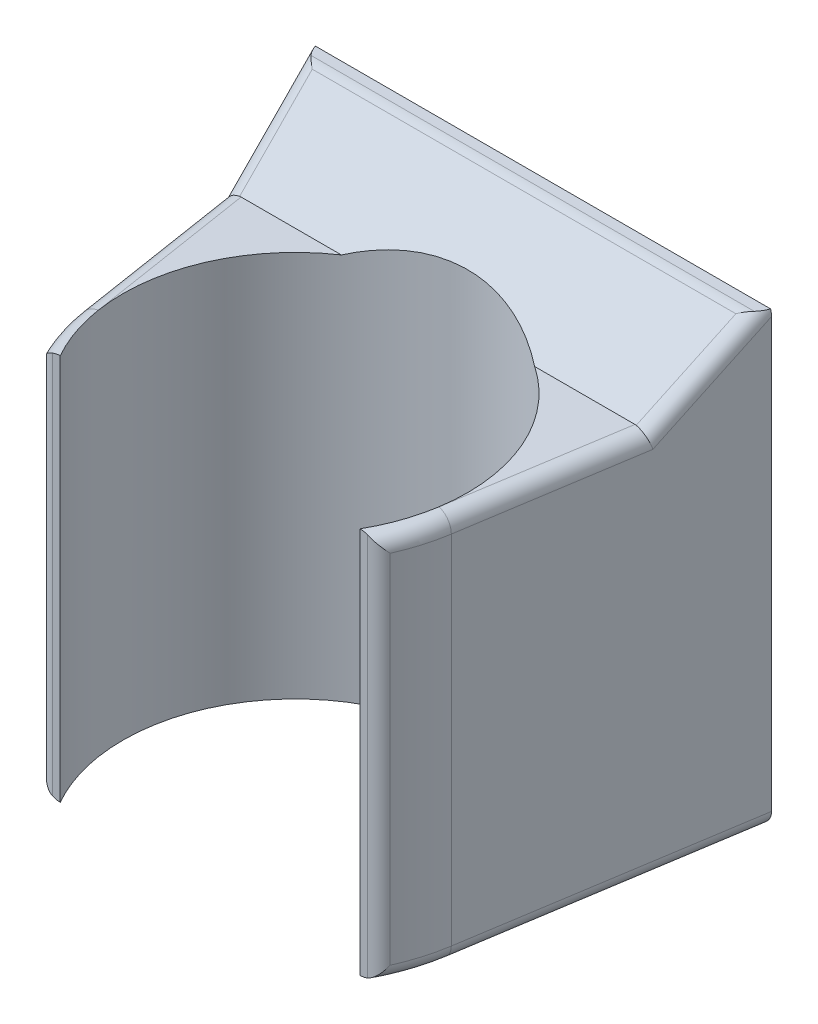
from build123d import *

# Parameters (mm, degrees)
SALIENTE_EXTRUIR1_DEPTH = 30
CORTAR_EXTRUIR1_START   = -4.2
CORTAR_EXTRUIR1_DEPTH   = 4.2
CHAFL_N1_SIZE           = 4.201245229
CHAFL_N1_SIZE_2         = 6
CORTAR_EXTRUIR2_DEPTH   = 38.490118291
REDONDEO1_R             = 1


with BuildPart() as part:
    # Croquis1 → Saliente-Extruir1 (new body)
    with BuildSketch(Plane(origin=(0, 0, 0), x_dir=(1, 0, 0), z_dir=(0, 1, 0))):
        with BuildLine():
            Line((11.135528726, -5.678908346), (-11.135528726, -5.678908346))
            ThreePointArc((-11.135528726, -5.678908346), (-11.889802545, -3.857796709), (-12.348419657, -1.940755517))
            Line((-12.348419657, -1.940755517), (-15.25, 16.521091654))
            Line((-15.25, 16.521091654), (15.25, 16.521091654))
            Line((15.25, 16.521091654), (12.348419657, -1.940755517))
            ThreePointArc((12.348419657, -1.940755517), (11.889802545, -3.857796709), (11.135528726, -5.678908346))
        make_face()
    extrude(amount=SALIENTE_EXTRUIR1_DEPTH)

    # Croquis4 → Cortar-Extruir1 (cut)
    with BuildSketch(Plane(origin=(0, 30, 0), x_dir=(1, 0, 0), z_dir=(0, 1, 0)).offset(CORTAR_EXTRUIR1_START)):
        with BuildLine():
            Line((-14.14983585, 9.521091654), (14.14983585, 9.521091654))
            Line((14.14983585, 9.521091654), (12.348419657, -1.940755517))
            ThreePointArc((12.348419657, -1.940755517), (11.889802545, -3.857796709), (11.135528726, -5.678908346))
            Line((11.135528726, -5.678908346), (-11.135528726, -5.678908346))
            ThreePointArc((-11.135528726, -5.678908346), (-11.889802545, -3.857796709), (-12.348419657, -1.940755517))
            Line((-12.348419657, -1.940755517), (-14.14983585, 9.521091654))
        make_face()
    extrude(amount=CORTAR_EXTRUIR1_DEPTH, mode=Mode.SUBTRACT)

    # Chaflán1
    # the kernel refuses this chamfer: 6, 4.201245229 mm, written as the material it takes off along each edge
    with BuildSketch(Plane(origin=(-29.645149232, 30, -9.521091654), x_dir=(0, -0.9989750717851553, 0.04526373771402067), z_dir=(1, 0, 0))) as chafl_n1_piece_1_section:
        Polygon((CHAFL_N1_SIZE * 0.998975071847, CHAFL_N1_SIZE * 0.0452637377168), (-CHAFL_N1_SIZE_2 * 0.045263737714, CHAFL_N1_SIZE_2 * 0.998975071785), (0, 0), align=None)
    chafl_n1_piece_1 = extrude(amount=59.290298463, mode=Mode.PRIVATE)
    chafl_n1_piece_1 = split(chafl_n1_piece_1, bisect_by=Plane(origin=(0, 25.8, -11.524605635), z_dir=(0, 1, 0)), keep=Keep.TOP, mode=Mode.PRIVATE)
    add(chafl_n1_piece_1, mode=Mode.SUBTRACT)

    # Croquis5 → Cortar-Extruir2 (cut, through all)
    with BuildSketch(Plane(origin=(0, 30, 0), x_dir=(1, 0, 0), z_dir=(0, 1, 0))):
        with BuildLine():
            ThreePointArc((11.5, 0), (-2.936835031, 11.118677979), (-10, -5.678908346))
            Line((-10, -5.678908346), (10, -5.678908346))
            ThreePointArc((10, -5.678908346), (11.118677979, -2.936835031), (11.5, 0))
        make_face()
        with BuildLine():
            Line((10, -5.678908346), (-10, -5.678908346))
            ThreePointArc((-10, -5.678908346), (0, -11.5), (10, -5.678908346))
        make_face()
    extrude(amount=-CORTAR_EXTRUIR2_DEPTH, mode=Mode.SUBTRACT)

    # Redondeo1
    # the kernel refuses this fillet: 1 mm, written as the material it takes off along each edge
    with BuildSketch(Plane(origin=(11.135528726, 0, 5.678908346), x_dir=(0.43073600418276364, 0, -0.9024779746346534), z_dir=(0, 1, 0))) as redondeo1_piece_1:
        with BuildLine():
            CenterArc((0.630943784, 0.999654376), REDONDEO1_R, 205.514277886, 65.992163004)
            Line((-0.27153419, 0.568918372), (-0.28958375, 0.560303652))
            Line((-0.28958375, 0.560303652), (-0.018049559, -0.00861472))
            Line((-0.018049559, -0.00861472), (-0.000525786, -0.019993088))
            ThreePointArc((-0.000525786, -0.019993088), (0.328616554, -0.0243203), (0.657758895, -0.019993088))
            Line((0.657758895, -0.019993088), (0.657233109, 0))
        make_face()
    extrude(amount=25.8, mode=Mode.SUBTRACT)
    with BuildSketch(Plane(origin=(-11.135528726, 0, 5.678908346), x_dir=(-0.43073600418276736, 0, -0.9024779746346517), z_dir=(0, 1, 0))) as redondeo1_piece_2:
        with BuildLine():
            CenterArc((0.630943784, -0.999654376), REDONDEO1_R, 88.493559111, 65.992163004)
            Line((-0.27153419, -0.568918372), (-0.28958375, -0.560303652))
            Line((-0.28958375, -0.560303652), (-0.018049559, 0.00861472))
            Line((-0.018049559, 0.00861472), (-0.000525786, 0.019993088))
            ThreePointArc((-0.000525786, 0.019993088), (0.328616554, 0.0243203), (0.657758895, 0.019993088))
            Line((0.657758895, 0.019993088), (0.657233109, 0))
        make_face()
    extrude(amount=25.8, mode=Mode.SUBTRACT)
    with BuildSketch(Plane(origin=(-15.881080665, 30, -15.521091654), x_dir=(0, -0.573576436351271, 0.8191520442888343), z_dir=(1, 0, 0))) as redondeo1_piece_3_section:
        with BuildLine():
            CenterArc((REDONDEO1_R * 0.315298788879, REDONDEO1_R), REDONDEO1_R, 235, 35)
            Line((-REDONDEO1_R * 0.258277647472, REDONDEO1_R * 0.180847955711), (-REDONDEO1_R * 0.269749176199, REDONDEO1_R * 0.164464914825))
            Line((-REDONDEO1_R * 0.269749176199, REDONDEO1_R * 0.164464914825), (-REDONDEO1_R * 0.00630597577758, -REDONDEO1_R * 0.02))
            Line((-REDONDEO1_R * 0.00630597577758, -REDONDEO1_R * 0.02), (REDONDEO1_R * 0.315298788879, -REDONDEO1_R * 0.02))
            Line((REDONDEO1_R * 0.315298788879, -REDONDEO1_R * 0.02), (REDONDEO1_R * 0.315298788879, 0))
        make_face()
    redondeo1_piece_3 = extrude(amount=31.76216133, mode=Mode.PRIVATE)
    redondeo1_piece_3 = split(redondeo1_piece_3, bisect_by=Plane(origin=(14.730786778, 29.963938904, -13.217500501), z_dir=(-0.9878735725575741, 0, -0.1552604413311243)), keep=Keep.TOP, mode=Mode.PRIVATE)
    redondeo1_piece_3 = split(redondeo1_piece_3, bisect_by=Plane(origin=(-14.730786778, 29.963938904, -13.217500501), z_dir=(0.9878735725575741, 0, -0.1552604413311243)), keep=Keep.TOP, mode=Mode.PRIVATE)
    add(redondeo1_piece_3, mode=Mode.SUBTRACT)
    with BuildSketch(Plane(origin=(0, 0, 0), x_dir=(-0.7828247498801871, 0, 0.622242244608177), z_dir=(0.622242244608177, 0, 0.7828247498801871))) as redondeo1_piece_4_section:
        with BuildLine():
            CenterArc((12.5 - REDONDEO1_R, -REDONDEO1_R), REDONDEO1_R, 0, 90)
            Line((12.5, -REDONDEO1_R), (12.5 + REDONDEO1_R * 0.02, -REDONDEO1_R))
            Line((12.5 + REDONDEO1_R * 0.02, -REDONDEO1_R), (12.5 + REDONDEO1_R * 0.02, REDONDEO1_R * 0.02))
            Line((12.5 + REDONDEO1_R * 0.02, REDONDEO1_R * 0.02), (12.5 - REDONDEO1_R, REDONDEO1_R * 0.02))
            Line((12.5 - REDONDEO1_R, REDONDEO1_R * 0.02), (12.5 - REDONDEO1_R, 0))
        make_face()
    redondeo1_piece_4 = revolve(axis=Axis((0, 0, 0), (0, -1, 0)), revolution_arc=29.548159275, mode=Mode.PRIVATE)
    redondeo1_piece_4 = split(redondeo1_piece_4, bisect_by=Plane(origin=(-11.602574927, 0.225035128, 5.678908346), z_dir=(0, 0, -1)), keep=Keep.TOP, mode=Mode.PRIVATE)
    add(redondeo1_piece_4, mode=Mode.SUBTRACT)
    with BuildSketch(Plane(origin=(0, 25.8, 0), x_dir=(-0.7828247498801902, 0, 0.6222422446081731), z_dir=(0.6222422446081731, 0, 0.7828247498801902))) as redondeo1_piece_5_section:
        with BuildLine():
            CenterArc((12.5 - REDONDEO1_R, REDONDEO1_R), REDONDEO1_R, 270, 90)
            Line((12.5 - REDONDEO1_R, 0), (12.5 - REDONDEO1_R, -REDONDEO1_R * 0.02))
            Line((12.5 - REDONDEO1_R, -REDONDEO1_R * 0.02), (12.5 + REDONDEO1_R * 0.02, -REDONDEO1_R * 0.02))
            Line((12.5 + REDONDEO1_R * 0.02, -REDONDEO1_R * 0.02), (12.5 + REDONDEO1_R * 0.02, REDONDEO1_R))
            Line((12.5 + REDONDEO1_R * 0.02, REDONDEO1_R), (12.5, REDONDEO1_R))
        make_face()
    redondeo1_piece_5 = revolve(axis=Axis((0, 25.8, 0), (0, -1, 0)), revolution_arc=29.548159275, mode=Mode.PRIVATE)
    redondeo1_piece_5 = split(redondeo1_piece_5, bisect_by=Plane(origin=(-11.60257492, 25.57496487, 5.678908346), z_dir=(0, 0, -1)), keep=Keep.TOP, mode=Mode.PRIVATE)
    add(redondeo1_piece_5, mode=Mode.SUBTRACT)
    with BuildSketch(Plane(origin=(0, 0, 0), x_dir=(0.9878735725575738, 0, 0.1552604413311257), z_dir=(0.1552604413311257, 0, -0.9878735725575738))) as redondeo1_piece_6_section:
        with BuildLine():
            CenterArc((12.5 - REDONDEO1_R, -REDONDEO1_R), REDONDEO1_R, 0, 90)
            Line((12.5 - REDONDEO1_R, 0), (12.5 - REDONDEO1_R, REDONDEO1_R * 0.02))
            Line((12.5 - REDONDEO1_R, REDONDEO1_R * 0.02), (12.5 + REDONDEO1_R * 0.02, REDONDEO1_R * 0.02))
            Line((12.5 + REDONDEO1_R * 0.02, REDONDEO1_R * 0.02), (12.5 + REDONDEO1_R * 0.02, -REDONDEO1_R))
            Line((12.5 + REDONDEO1_R * 0.02, -REDONDEO1_R), (12.5, -REDONDEO1_R))
        make_face()
    redondeo1_piece_6 = revolve(axis=Axis((0, 0, 0), (0, -1, 0)), revolution_arc=29.548159275, mode=Mode.PRIVATE)
    redondeo1_piece_6 = split(redondeo1_piece_6, bisect_by=Plane(origin=(11.602574265, 0.22503504, 5.678908346), z_dir=(0, 0, -1)), keep=Keep.TOP, mode=Mode.PRIVATE)
    add(redondeo1_piece_6, mode=Mode.SUBTRACT)
    with BuildSketch(Plane(origin=(0, 25.8, 0), x_dir=(0.9878735725575738, 0, 0.155260441331126), z_dir=(0.155260441331126, 0, -0.9878735725575738))) as redondeo1_piece_7_section:
        with BuildLine():
            CenterArc((12.5 - REDONDEO1_R, REDONDEO1_R), REDONDEO1_R, 270, 90)
            Line((12.5 - REDONDEO1_R, 0), (12.5 - REDONDEO1_R, -REDONDEO1_R * 0.02))
            Line((12.5 - REDONDEO1_R, -REDONDEO1_R * 0.02), (12.5 + REDONDEO1_R * 0.02, -REDONDEO1_R * 0.02))
            Line((12.5 + REDONDEO1_R * 0.02, -REDONDEO1_R * 0.02), (12.5 + REDONDEO1_R * 0.02, REDONDEO1_R))
            Line((12.5 + REDONDEO1_R * 0.02, REDONDEO1_R), (12.5, REDONDEO1_R))
        make_face()
    redondeo1_piece_7 = revolve(axis=Axis((0, 25.8, 0), (0, -1, 0)), revolution_arc=29.548159275, mode=Mode.PRIVATE)
    redondeo1_piece_7 = split(redondeo1_piece_7, bisect_by=Plane(origin=(11.602574265, 25.57496496, 5.678908346), z_dir=(0, 0, -1)), keep=Keep.TOP, mode=Mode.PRIVATE)
    add(redondeo1_piece_7, mode=Mode.SUBTRACT)
    with BuildSketch(Plane(origin=(-12.348419657, 0, 1.940755517), x_dir=(0.987873572557574, 0, -0.15526044133112427), z_dir=(-0.1552604413311243, 0, -0.9878735725575741))) as redondeo1_piece_8_section:
        with BuildLine():
            CenterArc((REDONDEO1_R, -REDONDEO1_R), REDONDEO1_R, 90, 90)
            Line((0, -REDONDEO1_R), (-REDONDEO1_R * 0.02, -REDONDEO1_R))
            Line((-REDONDEO1_R * 0.02, -REDONDEO1_R), (-REDONDEO1_R * 0.02, REDONDEO1_R * 0.02))
            Line((-REDONDEO1_R * 0.02, REDONDEO1_R * 0.02), (REDONDEO1_R, REDONDEO1_R * 0.02))
            Line((REDONDEO1_R, REDONDEO1_R * 0.02), (REDONDEO1_R, 0))
        make_face()
    redondeo1_piece_8 = extrude(amount=21.188471565, mode=Mode.PRIVATE)
    redondeo1_piece_8 = split(redondeo1_piece_8, bisect_by=Plane(origin=(-13.573189498, 0.22662646, -16.521091654), z_dir=(0, 0, 1)), keep=Keep.TOP, mode=Mode.PRIVATE)
    add(redondeo1_piece_8, mode=Mode.SUBTRACT)
    with BuildSketch(Plane(origin=(-14.538266453, 25.8, -11.992553957), x_dir=(0, -1, 0), z_dir=(0.15526044133112413, 0, 0.9878735725575741))) as redondeo1_piece_9_section:
        with BuildLine():
            CenterArc((REDONDEO1_R, REDONDEO1_R), REDONDEO1_R, 180, 90)
            Line((0, REDONDEO1_R), (-REDONDEO1_R * 0.02, REDONDEO1_R))
            Line((-REDONDEO1_R * 0.02, REDONDEO1_R), (-REDONDEO1_R * 0.02, -REDONDEO1_R * 0.02))
            Line((-REDONDEO1_R * 0.02, -REDONDEO1_R * 0.02), (REDONDEO1_R, -REDONDEO1_R * 0.02))
            Line((REDONDEO1_R, -REDONDEO1_R * 0.02), (REDONDEO1_R, 0))
        make_face()
    redondeo1_piece_9 = extrude(amount=14.104344788, mode=Mode.PRIVATE)
    redondeo1_piece_9 = split(redondeo1_piece_9, bisect_by=Plane(origin=(-12.995193868, 22.9685698, -5.47916863), z_dir=(0, 0.8191520442888341, 0.5735764363512712)), keep=Keep.TOP, mode=Mode.PRIVATE)
    add(redondeo1_piece_9, mode=Mode.SUBTRACT)
    with BuildSketch(Plane(origin=(15.638151103, 0, -18.990775586), x_dir=(-0.987873572557574, 0, -0.1552604413311243), z_dir=(-0.1552604413311243, 0, 0.9878735725575741))) as redondeo1_piece_10_section:
        with BuildLine():
            CenterArc((REDONDEO1_R, -REDONDEO1_R), REDONDEO1_R, 90, 90)
            Line((0, -REDONDEO1_R), (-REDONDEO1_R * 0.02, -REDONDEO1_R))
            Line((-REDONDEO1_R * 0.02, -REDONDEO1_R), (-REDONDEO1_R * 0.02, REDONDEO1_R * 0.02))
            Line((-REDONDEO1_R * 0.02, REDONDEO1_R * 0.02), (REDONDEO1_R, REDONDEO1_R * 0.02))
            Line((REDONDEO1_R, REDONDEO1_R * 0.02), (REDONDEO1_R, 0))
        make_face()
    redondeo1_piece_10 = extrude(amount=21.188471565, mode=Mode.PRIVATE)
    redondeo1_piece_10 = split(redondeo1_piece_10, bisect_by=Plane(origin=(13.573189498, 0.22662646, -16.521091654), z_dir=(0, 0, 1)), keep=Keep.TOP, mode=Mode.PRIVATE)
    add(redondeo1_piece_10, mode=Mode.SUBTRACT)
    with BuildSketch(Plane(origin=(12.348419657, 25.8, 1.940755517), x_dir=(-0.987873572557574, 0, -0.15526044133112424), z_dir=(0.15526044133112424, 0, -0.9878735725575741))) as redondeo1_piece_11_section:
        with BuildLine():
            CenterArc((REDONDEO1_R, -REDONDEO1_R), REDONDEO1_R, 90, 90)
            Line((0, -REDONDEO1_R), (-REDONDEO1_R * 0.02, -REDONDEO1_R))
            Line((-REDONDEO1_R * 0.02, -REDONDEO1_R), (-REDONDEO1_R * 0.02, REDONDEO1_R * 0.02))
            Line((-REDONDEO1_R * 0.02, REDONDEO1_R * 0.02), (REDONDEO1_R, REDONDEO1_R * 0.02))
            Line((REDONDEO1_R, REDONDEO1_R * 0.02), (REDONDEO1_R, 0))
        make_face()
    redondeo1_piece_11 = extrude(amount=14.104344788, mode=Mode.PRIVATE)
    redondeo1_piece_11 = split(redondeo1_piece_11, bisect_by=Plane(origin=(12.995193868, 22.9685698, -5.47916863), z_dir=(0, 0.8191520442888341, 0.5735764363512712)), keep=Keep.TOP, mode=Mode.PRIVATE)
    add(redondeo1_piece_11, mode=Mode.SUBTRACT)
    with BuildSketch(Plane(origin=(-13.858160269, 24.499281341, -7.665251265), x_dir=(-0.08832475689359706, -0.8224196627964561, -0.5619827715913099), z_dir=(-0.1276892398051722, 0.5688812690234787, -0.8124466504283305))) as redondeo1_piece_12_section:
        with BuildLine():
            CenterArc((REDONDEO1_R * 0.91458005738, -REDONDEO1_R), REDONDEO1_R, 90, 84.890828744)
            Line((-REDONDEO1_R * 0.0814467660832, -REDONDEO1_R * 0.910946269355), (-REDONDEO1_R * 0.101367302552, -REDONDEO1_R * 0.909165194742))
            Line((-REDONDEO1_R * 0.101367302552, -REDONDEO1_R * 0.909165194742), (-REDONDEO1_R * 0.0182916011476, REDONDEO1_R * 0.02))
            Line((-REDONDEO1_R * 0.0182916011476, REDONDEO1_R * 0.02), (REDONDEO1_R * 0.91458005738, REDONDEO1_R * 0.02))
            Line((REDONDEO1_R * 0.91458005738, REDONDEO1_R * 0.02), (REDONDEO1_R * 0.91458005738, 0))
        make_face()
    redondeo1_piece_12 = extrude(amount=11.955811676, mode=Mode.PRIVATE)
    redondeo1_piece_12 = split(redondeo1_piece_12, bisect_by=Plane(origin=(-14.470678042, 30, -12.878094062), z_dir=(0, -1, 0)), keep=Keep.TOP, mode=Mode.PRIVATE)
    redondeo1_piece_12 = split(redondeo1_piece_12, bisect_by=Plane(origin=(-14.470678042, 25.8, -12.878094062), z_dir=(0, 1, 0)), keep=Keep.TOP, mode=Mode.PRIVATE)
    add(redondeo1_piece_12, mode=Mode.SUBTRACT)
    with BuildSketch(Plane(origin=(15.384788774, 31.300718659, -17.378710415), x_dir=(0.08832475689359764, -0.8224196627964561, -0.5619827715913099), z_dir=(-0.1276892398051722, -0.5688812690234787, 0.8124466504283305))) as redondeo1_piece_13_section:
        with BuildLine():
            CenterArc((REDONDEO1_R * 0.91458005738, -REDONDEO1_R), REDONDEO1_R, 90, 84.890828744)
            Line((-REDONDEO1_R * 0.0814467660832, -REDONDEO1_R * 0.910946269355), (-REDONDEO1_R * 0.101367302553, -REDONDEO1_R * 0.909165194742))
            Line((-REDONDEO1_R * 0.101367302553, -REDONDEO1_R * 0.909165194742), (-REDONDEO1_R * 0.0182916011476, REDONDEO1_R * 0.02))
            Line((-REDONDEO1_R * 0.0182916011476, REDONDEO1_R * 0.02), (REDONDEO1_R * 0.91458005738, REDONDEO1_R * 0.02))
            Line((REDONDEO1_R * 0.91458005738, REDONDEO1_R * 0.02), (REDONDEO1_R * 0.91458005738, 0))
        make_face()
    redondeo1_piece_13 = extrude(amount=11.955811676, mode=Mode.PRIVATE)
    redondeo1_piece_13 = split(redondeo1_piece_13, bisect_by=Plane(origin=(14.470678042, 25.8, -12.878094062), z_dir=(0, 1, 0)), keep=Keep.TOP, mode=Mode.PRIVATE)
    redondeo1_piece_13 = split(redondeo1_piece_13, bisect_by=Plane(origin=(14.470678042, 30, -12.878094062), z_dir=(0, -1, 0)), keep=Keep.TOP, mode=Mode.PRIVATE)
    add(redondeo1_piece_13, mode=Mode.SUBTRACT)
    with BuildSketch(Plane(origin=(0, 0, 0), x_dir=(0.9878735725575738, 0, 0.1552604413311257), z_dir=(0.1552604413311257, 0, -0.9878735725575738))) as redondeo1_piece_14a_section:
        with BuildLine():
            CenterArc((12.5 - REDONDEO1_R, -REDONDEO1_R), REDONDEO1_R, 0, 90)
            Line((12.5 - REDONDEO1_R, 0), (12.5 - REDONDEO1_R, REDONDEO1_R * 0.02))
            Line((12.5 - REDONDEO1_R, REDONDEO1_R * 0.02), (12.5 + REDONDEO1_R * 0.02, REDONDEO1_R * 0.02))
            Line((12.5 + REDONDEO1_R * 0.02, REDONDEO1_R * 0.02), (12.5 + REDONDEO1_R * 0.02, -REDONDEO1_R))
            Line((12.5 + REDONDEO1_R * 0.02, -REDONDEO1_R), (12.5, -REDONDEO1_R))
        make_face()
    redondeo1_piece_14a = revolve(axis=Axis((0, 0, 0), (0, -1, 0)), revolution_arc=29.548159275, mode=Mode.PRIVATE)
    redondeo1_piece_14a = split(redondeo1_piece_14a, bisect_by=Plane(origin=(10.289138435, 0.234770185, 5.678908346), z_dir=(0, 0, 1)), keep=Keep.TOP, mode=Mode.PRIVATE)
    with BuildSketch(Plane(origin=(11.135528726, -1.643082772, 5.678908346), x_dir=(0.43073600418275976, 0, -0.9024779746346553), z_dir=(0, 1, 0))) as redondeo1_piece_14b_section:
        with BuildLine():
            CenterArc((0.630943784, 0.999654376), REDONDEO1_R, 205.514277886, 65.992163004)
            Line((-0.27153419, 0.568918372), (-0.28958375, 0.560303652))
            Line((-0.28958375, 0.560303652), (-0.018049559, -0.00861472))
            Line((-0.018049559, -0.00861472), (-0.000525786, -0.019993088))
            ThreePointArc((-0.000525786, -0.019993088), (0.328616554, -0.0243203), (0.657758895, -0.019993088))
            Line((0.657758895, -0.019993088), (0.657233109, 0))
        make_face()
    redondeo1_piece_14b = extrude(amount=27.443082772, mode=Mode.PRIVATE)
    redondeo1_piece_14b = split(redondeo1_piece_14b, bisect_by=Plane(origin=(11.06383799, 0, 5.549435466), z_dir=(0, -1, 0)), keep=Keep.TOP, mode=Mode.PRIVATE)
    redondeo1_piece_14 = redondeo1_piece_14a & redondeo1_piece_14b
    add(redondeo1_piece_14, mode=Mode.SUBTRACT)
    with BuildSketch(Plane(origin=(11.135528726, 0, 5.678908346), x_dir=(0.43073600418276364, 0, -0.9024779746346534), z_dir=(0, 1, 0))) as redondeo1_piece_15a_section:
        with BuildLine():
            CenterArc((0.630943784, 0.999654376), REDONDEO1_R, 205.514277886, 65.992163004)
            Line((-0.27153419, 0.568918372), (-0.28958375, 0.560303652))
            Line((-0.28958375, 0.560303652), (-0.018049559, -0.00861472))
            Line((-0.018049559, -0.00861472), (-0.000525786, -0.019993088))
            ThreePointArc((-0.000525786, -0.019993088), (0.328616554, -0.0243203), (0.657758895, -0.019993088))
            Line((0.657758895, -0.019993088), (0.657233109, 0))
        make_face()
    redondeo1_piece_15a = extrude(amount=27.443082772, mode=Mode.PRIVATE)
    redondeo1_piece_15a = split(redondeo1_piece_15a, bisect_by=Plane(origin=(11.06383799, 25.8, 5.549435466), z_dir=(0, 1, 0)), keep=Keep.TOP, mode=Mode.PRIVATE)
    with BuildSketch(Plane(origin=(0, 25.8, 0), x_dir=(0.9878735725575738, 0, 0.155260441331126), z_dir=(0.155260441331126, 0, -0.9878735725575738))) as redondeo1_piece_15b_section:
        with BuildLine():
            CenterArc((12.5 - REDONDEO1_R, REDONDEO1_R), REDONDEO1_R, 270, 90)
            Line((12.5 - REDONDEO1_R, 0), (12.5 - REDONDEO1_R, -REDONDEO1_R * 0.02))
            Line((12.5 - REDONDEO1_R, -REDONDEO1_R * 0.02), (12.5 + REDONDEO1_R * 0.02, -REDONDEO1_R * 0.02))
            Line((12.5 + REDONDEO1_R * 0.02, -REDONDEO1_R * 0.02), (12.5 + REDONDEO1_R * 0.02, REDONDEO1_R))
            Line((12.5 + REDONDEO1_R * 0.02, REDONDEO1_R), (12.5, REDONDEO1_R))
        make_face()
    redondeo1_piece_15b = revolve(axis=Axis((0, 25.8, 0), (0, -1, 0)), revolution_arc=29.548159275, mode=Mode.PRIVATE)
    redondeo1_piece_15b = split(redondeo1_piece_15b, bisect_by=Plane(origin=(10.289138435, 25.565229815, 5.678908346), z_dir=(0, 0, 1)), keep=Keep.TOP, mode=Mode.PRIVATE)
    redondeo1_piece_15 = redondeo1_piece_15a & redondeo1_piece_15b
    add(redondeo1_piece_15, mode=Mode.SUBTRACT)
    with BuildSketch(Plane(origin=(0, 0, 0), x_dir=(-0.7828247498801871, 0, 0.622242244608177), z_dir=(0.622242244608177, 0, 0.7828247498801871))) as redondeo1_piece_16a_section:
        with BuildLine():
            CenterArc((12.5 - REDONDEO1_R, -REDONDEO1_R), REDONDEO1_R, 0, 90)
            Line((12.5, -REDONDEO1_R), (12.5 + REDONDEO1_R * 0.02, -REDONDEO1_R))
            Line((12.5 + REDONDEO1_R * 0.02, -REDONDEO1_R), (12.5 + REDONDEO1_R * 0.02, REDONDEO1_R * 0.02))
            Line((12.5 + REDONDEO1_R * 0.02, REDONDEO1_R * 0.02), (12.5 - REDONDEO1_R, REDONDEO1_R * 0.02))
            Line((12.5 - REDONDEO1_R, REDONDEO1_R * 0.02), (12.5 - REDONDEO1_R, 0))
        make_face()
    redondeo1_piece_16a = revolve(axis=Axis((0, 0, 0), (0, -1, 0)), revolution_arc=29.548159275, mode=Mode.PRIVATE)
    redondeo1_piece_16a = split(redondeo1_piece_16a, bisect_by=Plane(origin=(-10.289138153, 0.234770148, 5.678908346), z_dir=(0, 0, 1)), keep=Keep.TOP, mode=Mode.PRIVATE)
    with BuildSketch(Plane(origin=(-11.135528726, -1.643082772, 5.678908346), x_dir=(-0.43073600418276686, 0, -0.902477974634652), z_dir=(0, 1, 0))) as redondeo1_piece_16b_section:
        with BuildLine():
            CenterArc((0.630943784, -0.999654376), REDONDEO1_R, 88.493559111, 65.992163004)
            Line((-0.27153419, -0.568918372), (-0.28958375, -0.560303652))
            Line((-0.28958375, -0.560303652), (-0.018049559, 0.00861472))
            Line((-0.018049559, 0.00861472), (-0.000525786, 0.019993088))
            ThreePointArc((-0.000525786, 0.019993088), (0.328616554, 0.0243203), (0.657758895, 0.019993088))
            Line((0.657758895, 0.019993088), (0.657233109, 0))
        make_face()
    redondeo1_piece_16b = extrude(amount=27.443082772, mode=Mode.PRIVATE)
    redondeo1_piece_16b = split(redondeo1_piece_16b, bisect_by=Plane(origin=(-11.06383799, 0, 5.549435466), z_dir=(0, -1, 0)), keep=Keep.TOP, mode=Mode.PRIVATE)
    redondeo1_piece_16 = redondeo1_piece_16a & redondeo1_piece_16b
    add(redondeo1_piece_16, mode=Mode.SUBTRACT)
    with BuildSketch(Plane(origin=(0, 25.8, 0), x_dir=(-0.7828247498801902, 0, 0.6222422446081731), z_dir=(0.6222422446081731, 0, 0.7828247498801902))) as redondeo1_piece_17a_section:
        with BuildLine():
            CenterArc((12.5 - REDONDEO1_R, REDONDEO1_R), REDONDEO1_R, 270, 90)
            Line((12.5 - REDONDEO1_R, 0), (12.5 - REDONDEO1_R, -REDONDEO1_R * 0.02))
            Line((12.5 - REDONDEO1_R, -REDONDEO1_R * 0.02), (12.5 + REDONDEO1_R * 0.02, -REDONDEO1_R * 0.02))
            Line((12.5 + REDONDEO1_R * 0.02, -REDONDEO1_R * 0.02), (12.5 + REDONDEO1_R * 0.02, REDONDEO1_R))
            Line((12.5 + REDONDEO1_R * 0.02, REDONDEO1_R), (12.5, REDONDEO1_R))
        make_face()
    redondeo1_piece_17a = revolve(axis=Axis((0, 25.8, 0), (0, -1, 0)), revolution_arc=29.548159275, mode=Mode.PRIVATE)
    redondeo1_piece_17a = split(redondeo1_piece_17a, bisect_by=Plane(origin=(-10.289138154, 25.565229849, 5.678908346), z_dir=(0, 0, 1)), keep=Keep.TOP, mode=Mode.PRIVATE)
    with BuildSketch(Plane(origin=(-11.135528726, 0, 5.678908346), x_dir=(-0.43073600418276736, 0, -0.9024779746346517), z_dir=(0, 1, 0))) as redondeo1_piece_17b_section:
        with BuildLine():
            CenterArc((0.630943784, -0.999654376), REDONDEO1_R, 88.493559111, 65.992163004)
            Line((-0.27153419, -0.568918372), (-0.28958375, -0.560303652))
            Line((-0.28958375, -0.560303652), (-0.018049559, 0.00861472))
            Line((-0.018049559, 0.00861472), (-0.000525786, 0.019993088))
            ThreePointArc((-0.000525786, 0.019993088), (0.328616554, 0.0243203), (0.657758895, 0.019993088))
            Line((0.657758895, 0.019993088), (0.657233109, 0))
        make_face()
    redondeo1_piece_17b = extrude(amount=27.443082772, mode=Mode.PRIVATE)
    redondeo1_piece_17b = split(redondeo1_piece_17b, bisect_by=Plane(origin=(-11.06383799, 25.8, 5.549435466), z_dir=(0, 1, 0)), keep=Keep.TOP, mode=Mode.PRIVATE)
    redondeo1_piece_17 = redondeo1_piece_17a & redondeo1_piece_17b
    add(redondeo1_piece_17, mode=Mode.SUBTRACT)
    with BuildSketch(Plane(origin=(-13.858160269, 24.499281341, -7.665251265), x_dir=(-0.08832475689359706, -0.8224196627964561, -0.5619827715913099), z_dir=(-0.1276892398051722, 0.5688812690234787, -0.8124466504283305))) as redondeo1_piece_18a_section:
        with BuildLine():
            CenterArc((REDONDEO1_R * 0.91458005738, -REDONDEO1_R), REDONDEO1_R, 90, 84.890828744)
            Line((-REDONDEO1_R * 0.0814467660832, -REDONDEO1_R * 0.910946269355), (-REDONDEO1_R * 0.101367302552, -REDONDEO1_R * 0.909165194742))
            Line((-REDONDEO1_R * 0.101367302552, -REDONDEO1_R * 0.909165194742), (-REDONDEO1_R * 0.0182916011476, REDONDEO1_R * 0.02))
            Line((-REDONDEO1_R * 0.0182916011476, REDONDEO1_R * 0.02), (REDONDEO1_R * 0.91458005738, REDONDEO1_R * 0.02))
            Line((REDONDEO1_R * 0.91458005738, REDONDEO1_R * 0.02), (REDONDEO1_R * 0.91458005738, 0))
        make_face()
    redondeo1_piece_18a = extrude(amount=11.955811676, mode=Mode.PRIVATE)
    redondeo1_piece_18a = split(redondeo1_piece_18a, bisect_by=Plane(origin=(-15.046076432, 30, -16.662987381), z_dir=(0, 1, 0)), keep=Keep.TOP, mode=Mode.PRIVATE)
    with BuildSketch(Plane(origin=(-15.881080665, 30, -15.521091654), x_dir=(0, -0.573576436351271, 0.8191520442888343), z_dir=(1, 0, 0))) as redondeo1_piece_18b_section:
        with BuildLine():
            CenterArc((REDONDEO1_R * 0.315298788879, REDONDEO1_R), REDONDEO1_R, 235, 35)
            Line((-REDONDEO1_R * 0.258277647472, REDONDEO1_R * 0.180847955711), (-REDONDEO1_R * 0.269749176199, REDONDEO1_R * 0.164464914825))
            Line((-REDONDEO1_R * 0.269749176199, REDONDEO1_R * 0.164464914825), (-REDONDEO1_R * 0.00630597577758, -REDONDEO1_R * 0.02))
            Line((-REDONDEO1_R * 0.00630597577758, -REDONDEO1_R * 0.02), (REDONDEO1_R * 0.315298788879, -REDONDEO1_R * 0.02))
            Line((REDONDEO1_R * 0.315298788879, -REDONDEO1_R * 0.02), (REDONDEO1_R * 0.315298788879, 0))
        make_face()
    redondeo1_piece_18b = extrude(amount=31.76216133, mode=Mode.PRIVATE)
    redondeo1_piece_18b = split(redondeo1_piece_18b, bisect_by=Plane(origin=(-15.103499013, 29.962685486, -15.588951744), z_dir=(-0.9878735725575741, 0, 0.1552604413311243)), keep=Keep.TOP, mode=Mode.PRIVATE)
    redondeo1_piece_18 = redondeo1_piece_18a & redondeo1_piece_18b
    add(redondeo1_piece_18, mode=Mode.SUBTRACT)
    with BuildSketch(Plane(origin=(15.384788774, 31.300718659, -17.378710415), x_dir=(0.08832475689359764, -0.8224196627964561, -0.5619827715913099), z_dir=(-0.1276892398051722, -0.5688812690234787, 0.8124466504283305))) as redondeo1_piece_19a_section:
        with BuildLine():
            CenterArc((REDONDEO1_R * 0.91458005738, -REDONDEO1_R), REDONDEO1_R, 90, 84.890828744)
            Line((-REDONDEO1_R * 0.0814467660832, -REDONDEO1_R * 0.910946269355), (-REDONDEO1_R * 0.101367302553, -REDONDEO1_R * 0.909165194742))
            Line((-REDONDEO1_R * 0.101367302553, -REDONDEO1_R * 0.909165194742), (-REDONDEO1_R * 0.0182916011476, REDONDEO1_R * 0.02))
            Line((-REDONDEO1_R * 0.0182916011476, REDONDEO1_R * 0.02), (REDONDEO1_R * 0.91458005738, REDONDEO1_R * 0.02))
            Line((REDONDEO1_R * 0.91458005738, REDONDEO1_R * 0.02), (REDONDEO1_R * 0.91458005738, 0))
        make_face()
    redondeo1_piece_19a = extrude(amount=11.955811676, mode=Mode.PRIVATE)
    redondeo1_piece_19a = split(redondeo1_piece_19a, bisect_by=Plane(origin=(15.046076432, 30, -16.662987381), z_dir=(0, 1, 0)), keep=Keep.TOP, mode=Mode.PRIVATE)
    with BuildSketch(Plane(origin=(-15.881080665, 30, -15.521091654), x_dir=(0, -0.573576436351271, 0.8191520442888343), z_dir=(1, 0, 0))) as redondeo1_piece_19b_section:
        with BuildLine():
            CenterArc((REDONDEO1_R * 0.315298788879, REDONDEO1_R), REDONDEO1_R, 235, 35)
            Line((-REDONDEO1_R * 0.258277647472, REDONDEO1_R * 0.180847955711), (-REDONDEO1_R * 0.269749176199, REDONDEO1_R * 0.164464914825))
            Line((-REDONDEO1_R * 0.269749176199, REDONDEO1_R * 0.164464914825), (-REDONDEO1_R * 0.00630597577758, -REDONDEO1_R * 0.02))
            Line((-REDONDEO1_R * 0.00630597577758, -REDONDEO1_R * 0.02), (REDONDEO1_R * 0.315298788879, -REDONDEO1_R * 0.02))
            Line((REDONDEO1_R * 0.315298788879, -REDONDEO1_R * 0.02), (REDONDEO1_R * 0.315298788879, 0))
        make_face()
    redondeo1_piece_19b = extrude(amount=31.76216133, mode=Mode.PRIVATE)
    redondeo1_piece_19b = split(redondeo1_piece_19b, bisect_by=Plane(origin=(15.103499013, 29.962685486, -15.588951744), z_dir=(0.9878735725575741, 0, 0.1552604413311243)), keep=Keep.TOP, mode=Mode.PRIVATE)
    redondeo1_piece_19 = redondeo1_piece_19a & redondeo1_piece_19b
    add(redondeo1_piece_19, mode=Mode.SUBTRACT)
    with BuildSketch(Plane(origin=(-14.538266453, 25.8, -11.992553957), x_dir=(0, -1, 0), z_dir=(0.15526044133112413, 0, 0.9878735725575741))) as redondeo1_piece_20a_section:
        with BuildLine():
            CenterArc((REDONDEO1_R, REDONDEO1_R), REDONDEO1_R, 180, 90)
            Line((0, REDONDEO1_R), (-REDONDEO1_R * 0.02, REDONDEO1_R))
            Line((-REDONDEO1_R * 0.02, REDONDEO1_R), (-REDONDEO1_R * 0.02, -REDONDEO1_R * 0.02))
            Line((-REDONDEO1_R * 0.02, -REDONDEO1_R * 0.02), (REDONDEO1_R, -REDONDEO1_R * 0.02))
            Line((REDONDEO1_R, -REDONDEO1_R * 0.02), (REDONDEO1_R, 0))
        make_face()
    redondeo1_piece_20a = extrude(amount=14.104344788, mode=Mode.PRIVATE)
    redondeo1_piece_20a = split(redondeo1_piece_20a, bisect_by=Plane(origin=(-14.1012205, 26.222998713, -10.126974795), z_dir=(0, -0.8191520442888341, -0.5735764363512712)), keep=Keep.TOP, mode=Mode.PRIVATE)
    with BuildSketch(Plane(origin=(-13.858160269, 24.499281341, -7.665251265), x_dir=(-0.08832475689359706, -0.8224196627964561, -0.5619827715913099), z_dir=(-0.1276892398051722, 0.5688812690234787, -0.8124466504283305))) as redondeo1_piece_20b_section:
        with BuildLine():
            CenterArc((REDONDEO1_R * 0.91458005738, -REDONDEO1_R), REDONDEO1_R, 90, 84.890828744)
            Line((-REDONDEO1_R * 0.0814467660832, -REDONDEO1_R * 0.910946269355), (-REDONDEO1_R * 0.101367302552, -REDONDEO1_R * 0.909165194742))
            Line((-REDONDEO1_R * 0.101367302552, -REDONDEO1_R * 0.909165194742), (-REDONDEO1_R * 0.0182916011476, REDONDEO1_R * 0.02))
            Line((-REDONDEO1_R * 0.0182916011476, REDONDEO1_R * 0.02), (REDONDEO1_R * 0.91458005738, REDONDEO1_R * 0.02))
            Line((REDONDEO1_R * 0.91458005738, REDONDEO1_R * 0.02), (REDONDEO1_R * 0.91458005738, 0))
        make_face()
    redondeo1_piece_20b = extrude(amount=11.955811676, mode=Mode.PRIVATE)
    redondeo1_piece_20b = split(redondeo1_piece_20b, bisect_by=Plane(origin=(-13.85557718, 25.8, -8.86674541), z_dir=(0, -1, 0)), keep=Keep.TOP, mode=Mode.PRIVATE)
    redondeo1_piece_20 = redondeo1_piece_20a & redondeo1_piece_20b
    add(redondeo1_piece_20, mode=Mode.SUBTRACT)
    with BuildSketch(Plane(origin=(12.348419657, 25.8, 1.940755517), x_dir=(-0.987873572557574, 0, -0.15526044133112424), z_dir=(0.15526044133112424, 0, -0.9878735725575741))) as redondeo1_piece_21a_section:
        with BuildLine():
            CenterArc((REDONDEO1_R, -REDONDEO1_R), REDONDEO1_R, 90, 90)
            Line((0, -REDONDEO1_R), (-REDONDEO1_R * 0.02, -REDONDEO1_R))
            Line((-REDONDEO1_R * 0.02, -REDONDEO1_R), (-REDONDEO1_R * 0.02, REDONDEO1_R * 0.02))
            Line((-REDONDEO1_R * 0.02, REDONDEO1_R * 0.02), (REDONDEO1_R, REDONDEO1_R * 0.02))
            Line((REDONDEO1_R, REDONDEO1_R * 0.02), (REDONDEO1_R, 0))
        make_face()
    redondeo1_piece_21a = extrude(amount=14.104344788, mode=Mode.PRIVATE)
    redondeo1_piece_21a = split(redondeo1_piece_21a, bisect_by=Plane(origin=(14.1012205, 26.222998713, -10.126974795), z_dir=(0, -0.8191520442888341, -0.5735764363512712)), keep=Keep.TOP, mode=Mode.PRIVATE)
    with BuildSketch(Plane(origin=(15.384788774, 31.300718659, -17.378710415), x_dir=(0.08832475689359764, -0.8224196627964561, -0.5619827715913099), z_dir=(-0.1276892398051722, -0.5688812690234787, 0.8124466504283305))) as redondeo1_piece_21b_section:
        with BuildLine():
            CenterArc((REDONDEO1_R * 0.91458005738, -REDONDEO1_R), REDONDEO1_R, 90, 84.890828744)
            Line((-REDONDEO1_R * 0.0814467660832, -REDONDEO1_R * 0.910946269355), (-REDONDEO1_R * 0.101367302553, -REDONDEO1_R * 0.909165194742))
            Line((-REDONDEO1_R * 0.101367302553, -REDONDEO1_R * 0.909165194742), (-REDONDEO1_R * 0.0182916011476, REDONDEO1_R * 0.02))
            Line((-REDONDEO1_R * 0.0182916011476, REDONDEO1_R * 0.02), (REDONDEO1_R * 0.91458005738, REDONDEO1_R * 0.02))
            Line((REDONDEO1_R * 0.91458005738, REDONDEO1_R * 0.02), (REDONDEO1_R * 0.91458005738, 0))
        make_face()
    redondeo1_piece_21b = extrude(amount=11.955811676, mode=Mode.PRIVATE)
    redondeo1_piece_21b = split(redondeo1_piece_21b, bisect_by=Plane(origin=(13.85557718, 25.8, -8.86674541), z_dir=(0, -1, 0)), keep=Keep.TOP, mode=Mode.PRIVATE)
    redondeo1_piece_21 = redondeo1_piece_21a & redondeo1_piece_21b
    add(redondeo1_piece_21, mode=Mode.SUBTRACT)


solid = part.part
